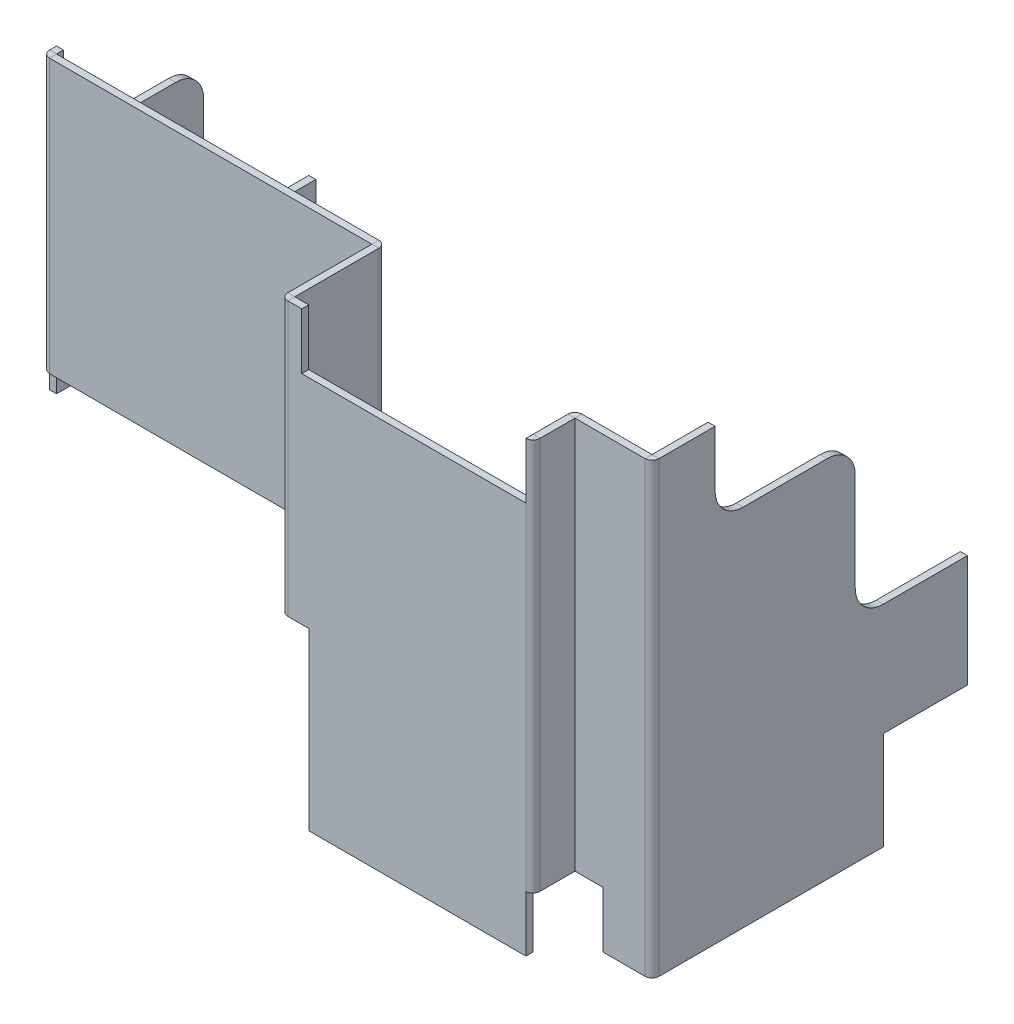
from build123d import *

# Parameters (mm, degrees)
BASE_FLANGE1_DEPTH      = 406.4
CUT_EXTRUDE1_START      = -88.9254
CUT_EXTRUDE1_OUTLINE_W  = 324.85
CUT_EXTRUDE1_OUTLINE_H  = 158.75
CUT_EXTRUDE1_DEPTH      = 88.9254
CUT_EXTRUDE2_REACH      = 763.365
CUT_EXTRUDE3_REACH      = 763.365
SKETCH5_W               = 76.2
SKETCH5_H               = 88.9
CUT_EXTRUDE4_REACH      = 778.597
SKETCH6_W               = 25.4
SKETCH6_H               = 50.8
CUT_EXTRUDE5_REACH      = 793.41
SKETCH8_W               = 31.8008
SKETCH8_H               = 50.8
SKETCH9_W               = 203.2
SKETCH9_H               = 50.8
CUT_EXTRUDE6_DEPTH      = 792.409750066
CUT_EXTRUDE8_DEPTH      = 757.396689906
CUT_EXTRUDE8_DEPTH_BACK = 757.396689906


# Read off the part's stored shape, not the designer's step: Cut-Extrude1
# Sheet-metal steps are written as plain solids
with BuildPart() as part:
    # Sketch2 → Base-Flange1 (new body)
    with BuildSketch(Plane(origin=(0, 0, 0), x_dir=(1, 0, 0), z_dir=(0, 1, 0))):
        with BuildLine():
            Line((596.9, 241.3), (596.9, -38.0746))
            ThreePointArc((596.9, -38.0746), (595.032688573, -42.582688573), (590.5246, -44.45))
            Line((590.5246, -44.45), (527.0754, -44.45))
            ThreePointArc((527.0754, -44.45), (527.057439485, -44.457439486), (527.05, -44.4754))
            Line((527.05, -44.4754), (527.05, -76.1746))
            ThreePointArc((527.05, -76.1746), (525.182688573, -80.682688573), (520.6746, -82.55))
            Line((520.6746, -82.55), (304.8254, -82.55))
            ThreePointArc((304.8254, -82.55), (300.317311427, -80.682688573), (298.45, -76.1746))
            Line((298.45, -76.1746), (298.45, -0.0254))
            ThreePointArc((298.45, -0.0254), (298.442560512, -0.007439487), (298.4246, 0))
            Line((298.4246, 0), (6.3754, 0))
            ThreePointArc((6.3754, 0), (1.867311427, 1.867311427), (0, 6.3754))
            Line((0, 6.3754), (0, 241.3))
            Line((0, 241.3), (6.35, 241.3))
            Line((6.35, 241.3), (6.35, 6.3754))
            ThreePointArc((6.35, 6.3754), (6.357439488, 6.357439488), (6.3754, 6.35))
            Line((6.3754, 6.35), (298.424685325, 6.35))
            ThreePointArc((298.424685325, 6.35), (302.932718863, 4.482658283), (304.8, -0.025400347))
            Line((304.8, -0.025400347), (304.8, -76.1746))
            ThreePointArc((304.8, -76.1746), (304.807439488, -76.192560512), (304.8254, -76.2))
            Line((304.8254, -76.2), (520.6746, -76.2))
            ThreePointArc((520.6746, -76.2), (520.692560512, -76.192560512), (520.7, -76.1746))
            Line((520.7, -76.1746), (520.7, -44.47559657))
            ThreePointArc((520.7, -44.47559657), (522.567241925, -39.967380926), (527.075399994, -38.1))
            Line((527.075399994, -38.1), (590.5246, -38.1))
            ThreePointArc((590.5246, -38.1), (590.542560512, -38.092560512), (590.55, -38.0746))
            Line((590.55, -38.0746), (590.55, 241.3))
            Line((590.55, 241.3), (596.9, 241.3))
        make_face()
    extrude(amount=BASE_FLANGE1_DEPTH)

    # Cut-Extrude1 outline → Cut-Extrude1 (cut)
    with BuildSketch(Plane.XY.offset(82.55).offset(CUT_EXTRUDE1_START)):
        with Locations((161.425, 79.375)):
            Rectangle(CUT_EXTRUDE1_OUTLINE_W, CUT_EXTRUDE1_OUTLINE_H)
    extrude(amount=CUT_EXTRUDE1_DEPTH, mode=Mode.SUBTRACT)

    # Sketch4 → Cut-Extrude2 (cut, up to next)
    with BuildSketch(Plane.ZY, mode=Mode.PRIVATE) as cut_extrude2_sk1:
        Polygon((-241.3, 0), (-6.3754, 0), (-6.3754, 139.7), (-82.5754, 139.7), (-82.5754, 88.9), (-241.3, 88.9), align=None)
    cut_extrude2_tool1 = extrude(cut_extrude2_sk1.sketch, amount=-CUT_EXTRUDE2_REACH, mode=Mode.PRIVATE) & part.part
    add(cut_extrude2_tool1.solids().sort_by_distance((0, 55.372169, -111.42813))[0], mode=Mode.SUBTRACT)

    # Sketch5 → Cut-Extrude3 (cut, up to next)
    with BuildSketch(Plane(origin=(596.9, 0, 0), x_dir=(0, 0, -1), z_dir=(1, 0, 0)), mode=Mode.PRIVATE) as cut_extrude3_sk1:
        with Locations((203.2, 44.45)):
            Rectangle(SKETCH5_W, SKETCH5_H)
    cut_extrude3_tool1 = extrude(cut_extrude3_sk1.sketch, amount=-CUT_EXTRUDE3_REACH, mode=Mode.PRIVATE) & part.part
    add(cut_extrude3_tool1.solids().sort_by_distance((596.9, 44.45, -203.2))[0], mode=Mode.SUBTRACT)

    # Sketch6 → Cut-Extrude4 (cut, up to next)
    with BuildSketch(Plane.XY.offset(44.45), mode=Mode.PRIVATE) as cut_extrude4_sk1:
        with Locations((539.7754, 25.4)):
            Rectangle(SKETCH6_W, SKETCH6_H)
    cut_extrude4_tool1 = extrude(cut_extrude4_sk1.sketch, amount=-CUT_EXTRUDE4_REACH, mode=Mode.PRIVATE) & part.part
    add(cut_extrude4_tool1.solids().sort_by_distance((539.7754, 25.4, 44.45))[0], mode=Mode.SUBTRACT)

    # Sketch8 → Cut-Extrude5 (cut, up to next)
    with BuildSketch(Plane.XY.offset(82.55), mode=Mode.PRIVATE) as cut_extrude5_sk1:
        with Locations((536.575, 25.4)):
            Rectangle(SKETCH8_W, SKETCH8_H)
    cut_extrude5_tool1 = extrude(cut_extrude5_sk1.sketch, amount=-CUT_EXTRUDE5_REACH, mode=Mode.PRIVATE) & part.part
    add(cut_extrude5_tool1.solids().sort_by_distance((536.575, 25.4, 82.55))[0], mode=Mode.SUBTRACT)

    # Sketch9 → Cut-Extrude6 (cut, through all)
    with BuildSketch(Plane.XY.offset(82.55)):
        with Locations((419.0746, 381)):
            Rectangle(SKETCH9_W, SKETCH9_H)
    extrude(amount=-CUT_EXTRUDE6_DEPTH, mode=Mode.SUBTRACT)

    # Sketch11 → Cut-Extrude8 (cut, two sides: drawn at the far end of the back side and taken through both)
    with BuildSketch(Plane(origin=(6.35, 0, 0), x_dir=(0, 0, -1), z_dir=(1, 0, 0)).offset(-CUT_EXTRUDE8_DEPTH_BACK)):
        with BuildLine():
            Line((12.7, 406.4), (12.7, 355.6))
            ThreePointArc((12.7, 355.6), (20.139487758, 337.639487758), (38.1, 330.2))
            Line((38.1, 330.2), (114.3, 330.2))
            ThreePointArc((114.3, 330.2), (132.260512242, 322.760512242), (139.7, 304.8))
            Line((139.7, 304.8), (139.7, 215.9))
            ThreePointArc((139.7, 215.9), (147.139487758, 197.939487758), (165.1, 190.5))
            Line((165.1, 190.5), (241.3, 190.5))
            Line((241.3, 190.5), (241.3, 406.4))
            Line((241.3, 406.4), (12.7, 406.4))
        make_face()
    extrude(amount=CUT_EXTRUDE8_DEPTH + CUT_EXTRUDE8_DEPTH_BACK, mode=Mode.SUBTRACT)


solid = part.part
